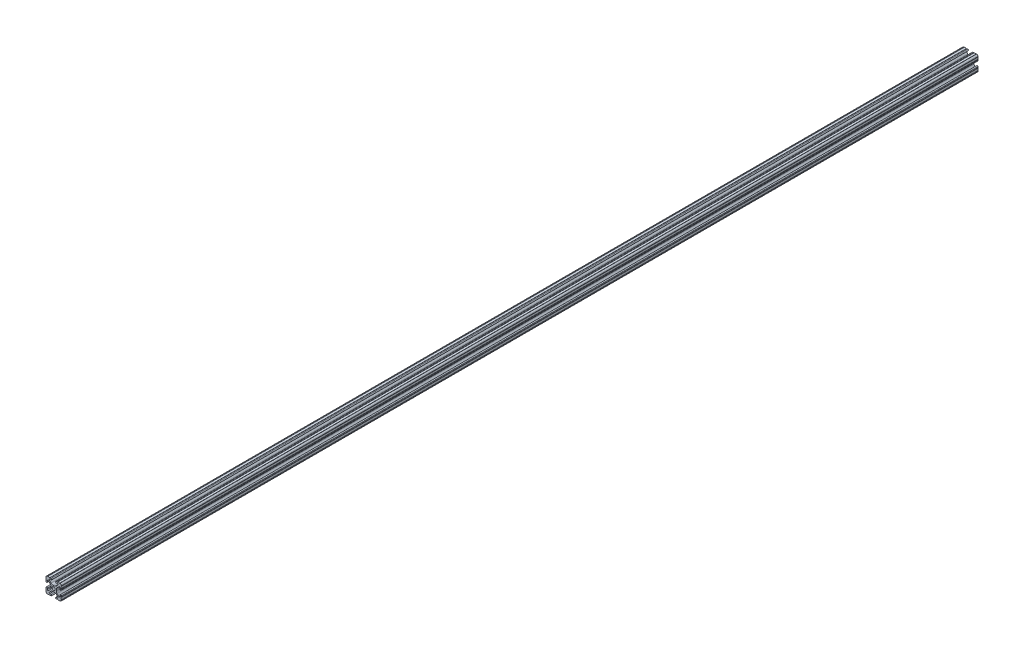
from build123d import *

# Parameters (mm, degrees)
SKETCH3_R      = 2.6035
EXTRUDE1_DEPTH = 762


with BuildPart() as part:
    # Sketch3 → Extrude1 (new, symmetric)
    with BuildSketch(Plane.XY):
        with BuildLine():
            Line((-1.115277175, 4.5085), (1.115277175, 4.5085))
            ThreePointArc((1.115277175, 4.5085), (2.806584872, 4.844922018), (4.240406305, 5.80297087))
            Line((4.240406305, 5.80297087), (7.148423664, 8.710988229))
            ThreePointArc((7.148423664, 8.710988229), (7.349906316, 9.772227925), (6.436353897, 10.348636575))
            Line((6.436353897, 10.348636575), (4.381960454, 10.276895575))
            ThreePointArc((4.381960454, 10.276895575), (3.239173075, 11.342562046), (4.304839546, 12.485349424))
            Line((4.304839546, 12.485349424), (5.728246175, 12.535055879))
            ThreePointArc((5.728246175, 12.535055879), (6.054756855, 12.230579745), (6.35923299, 12.557090424))
            Line((6.35923299, 12.557090424), (9.782092278, 12.676619304))
            ThreePointArc((9.782092278, 12.676619304), (10.108602958, 12.37214317), (10.413079092, 12.69865385))
            ThreePointArc((10.413079092, 12.69865385), (12.052764565, 12.052764565), (12.69865385, 10.413079092))
            ThreePointArc((12.69865385, 10.413079092), (12.37214317, 10.108602958), (12.676619304, 9.782092278))
            Line((12.676619304, 9.782092278), (12.557090424, 6.35923299))
            ThreePointArc((12.557090424, 6.35923299), (12.230579745, 6.054756855), (12.535055879, 5.728246175))
            Line((12.535055879, 5.728246175), (12.485349424, 4.304839546))
            ThreePointArc((12.485349424, 4.304839546), (11.342562046, 3.239173075), (10.276895575, 4.381960454))
            Line((10.276895575, 4.381960454), (10.348636575, 6.436353897))
            ThreePointArc((10.348636575, 6.436353897), (9.772227925, 7.349906316), (8.710988229, 7.148423664))
            Line((8.710988229, 7.148423664), (5.80297087, 4.240406305))
            ThreePointArc((5.80297087, 4.240406305), (4.844922018, 2.806584872), (4.5085, 1.115277175))
            Line((4.5085, 1.115277175), (4.5085, -1.115277175))
            ThreePointArc((4.5085, -1.115277175), (4.844922018, -2.806584872), (5.80297087, -4.240406305))
            Line((5.80297087, -4.240406305), (8.710988229, -7.148423664))
            ThreePointArc((8.710988229, -7.148423664), (9.772227925, -7.349906316), (10.348636575, -6.436353897))
            Line((10.348636575, -6.436353897), (10.276895575, -4.381960454))
            ThreePointArc((10.276895575, -4.381960454), (11.342562046, -3.239173075), (12.485349424, -4.304839546))
            Line((12.485349424, -4.304839546), (12.535055879, -5.728246175))
            ThreePointArc((12.535055879, -5.728246175), (12.230579745, -6.054756855), (12.557090424, -6.35923299))
            Line((12.557090424, -6.35923299), (12.676619304, -9.782092278))
            ThreePointArc((12.676619304, -9.782092278), (12.37214317, -10.108602958), (12.69865385, -10.413079092))
            ThreePointArc((12.69865385, -10.413079092), (12.052764565, -12.052764565), (10.413079092, -12.69865385))
            ThreePointArc((10.413079092, -12.69865385), (10.108602958, -12.37214317), (9.782092278, -12.676619304))
            Line((9.782092278, -12.676619304), (6.35923299, -12.557090424))
            ThreePointArc((6.35923299, -12.557090424), (6.054756855, -12.230579745), (5.728246175, -12.535055879))
            Line((5.728246175, -12.535055879), (4.304839546, -12.485349424))
            ThreePointArc((4.304839546, -12.485349424), (3.239173075, -11.342562046), (4.381960454, -10.276895575))
            Line((4.381960454, -10.276895575), (6.436353897, -10.348636575))
            ThreePointArc((6.436353897, -10.348636575), (7.349906316, -9.772227925), (7.148423664, -8.710988229))
            Line((7.148423664, -8.710988229), (4.240406305, -5.80297087))
            ThreePointArc((4.240406305, -5.80297087), (2.806584872, -4.844922018), (1.115277175, -4.5085))
            Line((1.115277175, -4.5085), (-1.115277175, -4.5085))
            ThreePointArc((-1.115277175, -4.5085), (-2.806584872, -4.844922018), (-4.240406305, -5.80297087))
            Line((-4.240406305, -5.80297087), (-7.148423664, -8.710988229))
            ThreePointArc((-7.148423664, -8.710988229), (-7.349906316, -9.772227925), (-6.436353897, -10.348636575))
            Line((-6.436353897, -10.348636575), (-4.381960454, -10.276895575))
            ThreePointArc((-4.381960454, -10.276895575), (-3.239173075, -11.342562046), (-4.304839546, -12.485349424))
            Line((-4.304839546, -12.485349424), (-5.728246175, -12.535055879))
            ThreePointArc((-5.728246175, -12.535055879), (-6.054756855, -12.230579745), (-6.35923299, -12.557090424))
            Line((-6.35923299, -12.557090424), (-9.782092278, -12.676619304))
            ThreePointArc((-9.782092278, -12.676619304), (-10.108602958, -12.37214317), (-10.413079092, -12.69865385))
            ThreePointArc((-10.413079092, -12.69865385), (-12.052764565, -12.052764565), (-12.69865385, -10.413079092))
            ThreePointArc((-12.69865385, -10.413079092), (-12.37214317, -10.108602958), (-12.676619304, -9.782092278))
            Line((-12.676619304, -9.782092278), (-12.557090424, -6.35923299))
            ThreePointArc((-12.557090424, -6.35923299), (-12.230579745, -6.054756855), (-12.535055879, -5.728246175))
            Line((-12.535055879, -5.728246175), (-12.485349424, -4.304839546))
            ThreePointArc((-12.485349424, -4.304839546), (-11.342562046, -3.239173075), (-10.276895575, -4.381960454))
            Line((-10.276895575, -4.381960454), (-10.348636575, -6.436353897))
            ThreePointArc((-10.348636575, -6.436353897), (-9.772227925, -7.349906316), (-8.710988229, -7.148423664))
            Line((-8.710988229, -7.148423664), (-5.80297087, -4.240406305))
            ThreePointArc((-5.80297087, -4.240406305), (-4.844922018, -2.806584872), (-4.5085, -1.115277175))
            Line((-4.5085, -1.115277175), (-4.5085, 1.115277175))
            ThreePointArc((-4.5085, 1.115277175), (-4.844922018, 2.806584872), (-5.80297087, 4.240406305))
            Line((-5.80297087, 4.240406305), (-8.710988229, 7.148423664))
            ThreePointArc((-8.710988229, 7.148423664), (-9.772227925, 7.349906316), (-10.348636575, 6.436353897))
            Line((-10.348636575, 6.436353897), (-10.276895575, 4.381960454))
            ThreePointArc((-10.276895575, 4.381960454), (-11.342562046, 3.239173075), (-12.485349424, 4.304839546))
            Line((-12.485349424, 4.304839546), (-12.535055879, 5.728246175))
            ThreePointArc((-12.535055879, 5.728246175), (-12.230579745, 6.054756855), (-12.557090424, 6.35923299))
            Line((-12.557090424, 6.35923299), (-12.676619304, 9.782092278))
            ThreePointArc((-12.676619304, 9.782092278), (-12.37214317, 10.108602958), (-12.69865385, 10.413079092))
            ThreePointArc((-12.69865385, 10.413079092), (-12.052764565, 12.052764565), (-10.413079092, 12.69865385))
            ThreePointArc((-10.413079092, 12.69865385), (-10.108602958, 12.37214317), (-9.782092278, 12.676619304))
            Line((-9.782092278, 12.676619304), (-6.35923299, 12.557090424))
            ThreePointArc((-6.35923299, 12.557090424), (-6.054756855, 12.230579745), (-5.728246175, 12.535055879))
            Line((-5.728246175, 12.535055879), (-4.304839546, 12.485349424))
            ThreePointArc((-4.304839546, 12.485349424), (-3.239173075, 11.342562046), (-4.381960454, 10.276895575))
            Line((-4.381960454, 10.276895575), (-6.436353897, 10.348636575))
            ThreePointArc((-6.436353897, 10.348636575), (-7.349906316, 9.772227925), (-7.148423664, 8.710988229))
            Line((-7.148423664, 8.710988229), (-4.240406305, 5.80297087))
            ThreePointArc((-4.240406305, 5.80297087), (-2.806584872, 4.844922018), (-1.115277175, 4.5085))
        make_face()
        Circle(SKETCH3_R, mode=Mode.SUBTRACT)
    extrude(amount=EXTRUDE1_DEPTH, both=True)


solid = part.part
